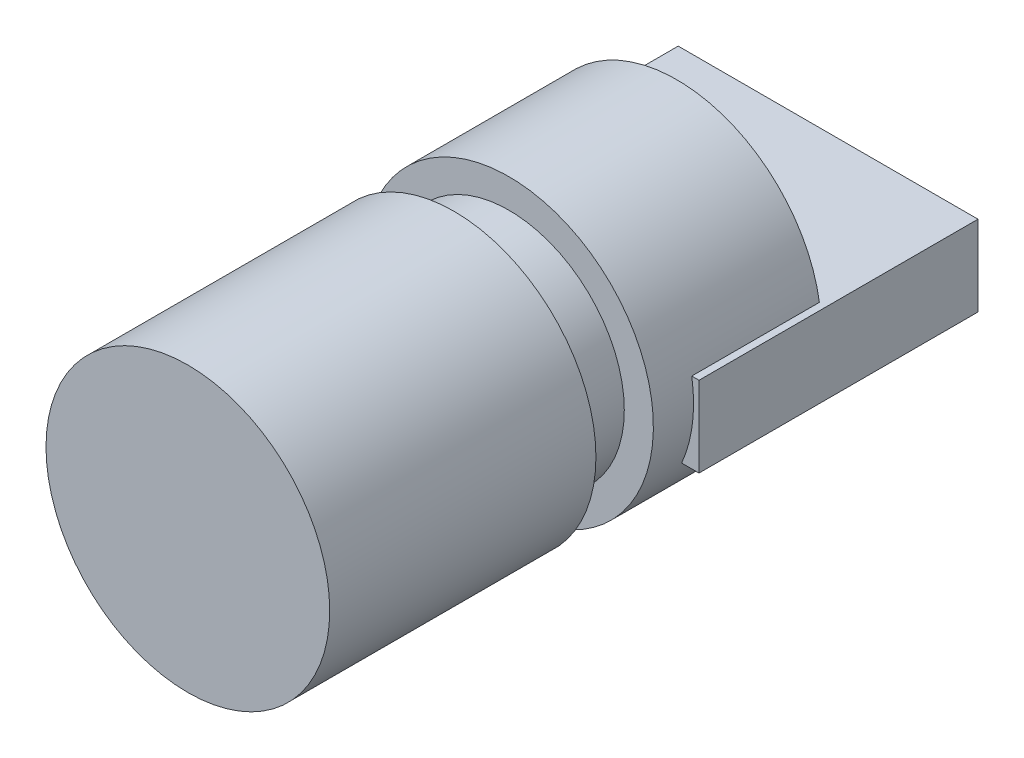
from build123d import *

# Parameters (mm, degrees)
SKETCH3_R           = 3
BOSS_EXTRUDE1_DEPTH = 5.63
SKETCH8_R           = 2.44
BOSS_EXTRUDE2_DEPTH = 1.16
SKETCH9_R           = 3.055
BOSS_EXTRUDE3_DEPTH = 3.55
BOSS_EXTRUDE4_START = 0.485
SKETCH15_W          = 6.34
SKETCH15_H          = 5.9
BOSS_EXTRUDE4_DEPTH = 1.7


with BuildPart() as part:
    # Sketch3 → Boss-Extrude1 (new body)
    with BuildSketch(Plane.XY):
        with Locations((-7.67170946, 4.798899109)):
            Circle(SKETCH3_R)
    extrude(amount=BOSS_EXTRUDE1_DEPTH)

    # Sketch8 → Boss-Extrude2 (add)
    with BuildSketch(Plane(origin=(0, 0, 0), x_dir=(-1, 0, 0), z_dir=(0, 0, -1))):
        with Locations((7.67170946, 4.798899109)):
            Circle(SKETCH8_R)
    extrude(amount=BOSS_EXTRUDE2_DEPTH)

    # Sketch9 → Boss-Extrude3 (add)
    with BuildSketch(Plane(origin=(0, 0, -1.16), x_dir=(-1, 0, 0), z_dir=(0, 0, -1))):
        with Locations((7.67170946, 4.798899109)):
            Circle(SKETCH9_R)
    extrude(amount=BOSS_EXTRUDE3_DEPTH)

    # Sketch15 → Boss-Extrude4 (add)
    with BuildSketch(Plane(origin=(0, 4.798899109, 0), x_dir=(1, 0, 0), z_dir=(0, 1, 0)).offset(BOSS_EXTRUDE4_START)):
        with Locations((-7.67170946, 4.96)):
            Rectangle(SKETCH15_W, SKETCH15_H)
    extrude(amount=-BOSS_EXTRUDE4_DEPTH)


solid = part.part
